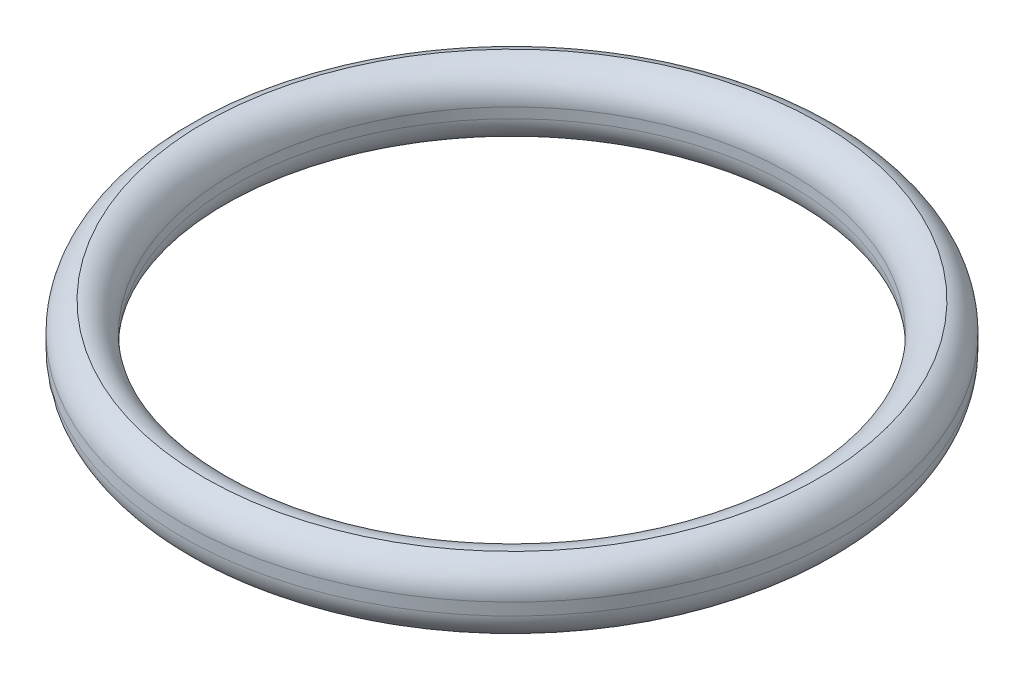
from build123d import *

# Parameters (mm, degrees)
SKETCH3_R           = 22.5
SKETCH3_R_2         = 19
BOSS_EXTRUDE1_DEPTH = 4.7
FILLET1_R           = 2
FILLET2_R           = 2


with BuildPart() as part:
    # Sketch3 → Boss-Extrude1 (new body)
    with BuildSketch(Plane(origin=(0, 0, 0), x_dir=(1, 0, 0), z_dir=(0, 1, 0))):
        with Locations(Location((0, 0, 0), (0, 0, 270))):
            Circle(SKETCH3_R)
        with Locations(Location((0, 0, 0), (0, 0, 270))):
            Circle(SKETCH3_R_2, mode=Mode.SUBTRACT)
    extrude(amount=BOSS_EXTRUDE1_DEPTH)

    # Fillet1
    fillet1_edges = [part.edges().sort_by_distance(p)[0] for p in [
        (0, 0, -19),
        (0, 4.7, -19),
    ]]
    fillet(fillet1_edges, radius=FILLET1_R)

    # Fillet2
    # the kernel refuses this fillet: 2 mm, written as the material it takes off along each edge
    with BuildSketch(Plane(origin=(0, 0, 0), x_dir=(0, 0, 1), z_dir=(-1, 0, 0))) as fillet2_piece_1:
        with BuildLine():
            CenterArc((20.5, 1.936491673), FILLET2_R, 284.477512186, 75.522487814)
            Line((22.5, 1.936491673), (22.54, 1.936491673))
            Line((22.54, 1.936491673), (22.54, 0))
            Line((22.54, 0), (22.5, -0.04))
            ThreePointArc((22.5, -0.04), (21.75, -0.04), (21.01, -0.038729833))
            Line((21.01, -0.038729833), (21, 0))
        make_face()
    revolve(axis=Axis((0, 0, 0), (0, 1, 0)), mode=Mode.SUBTRACT)
    with BuildSketch(Plane(origin=(0, 4.7, 0), x_dir=(0, 0, 1), z_dir=(-1, 0, 0))) as fillet2_piece_2:
        with BuildLine():
            CenterArc((20.5, -1.936491673), FILLET2_R, 0, 75.522487814)
            Line((22.5, -1.936491673), (22.54, -1.936491673))
            Line((22.54, -1.936491673), (22.54, 0))
            Line((22.54, 0), (22.5, 0.04))
            ThreePointArc((22.5, 0.04), (21.75, 0.04), (21.01, 0.038729833))
            Line((21.01, 0.038729833), (21, 0))
        make_face()
    revolve(axis=Axis((0, 4.7, 0), (0, 1, 0)), mode=Mode.SUBTRACT)


solid = part.part
